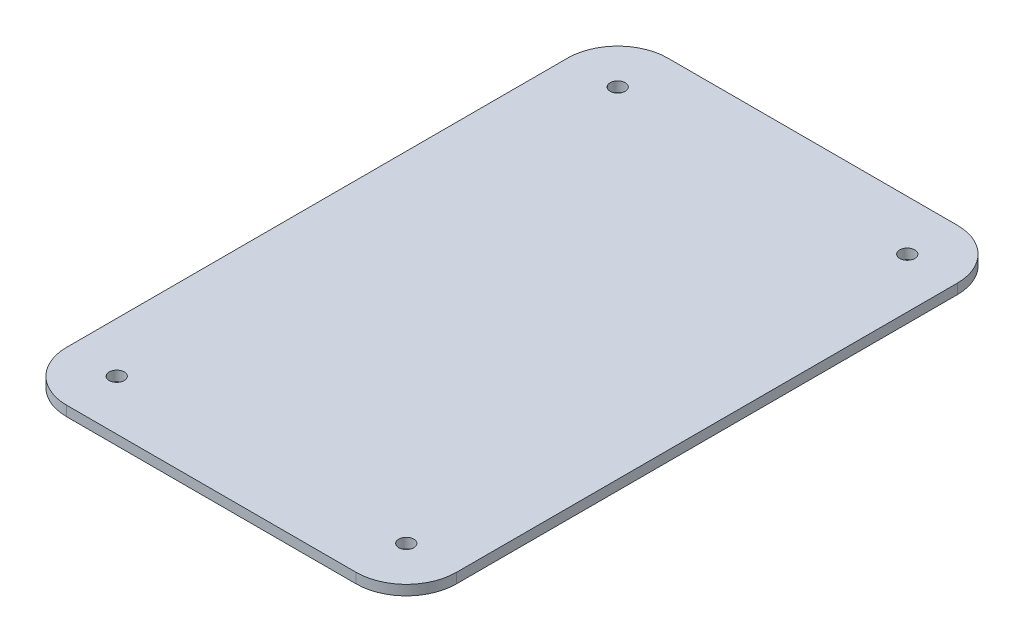
from build123d import *

# Parameters (mm, degrees)
SKETCH1_W           = 77.8
SKETCH1_H           = 120
BOSS_EXTRUDE1_DEPTH = 2
FILLET1_R           = 10
SKETCH2_R           = 1.5
CUT_EXTRUDE1_DEPTH  = 21


with BuildPart() as part:
    # Sketch1 → Boss-Extrude1 (new body)
    with BuildSketch(Plane(origin=(0, 0, 0), x_dir=(1, 0, 0), z_dir=(0, 1, 0))):
        with Locations((-4.469169002, 27.069255629)):
            Rectangle(SKETCH1_W, SKETCH1_H)
    extrude(amount=BOSS_EXTRUDE1_DEPTH)

    # Fillet1
    fillet1_edges = [part.edges().sort_by_distance(p)[0] for p in [
        (-43.369169002, 1, -87.069255629),
        (34.430830998, 1, -87.069255629),
        (34.430830998, 1, 32.930744371),
        (-43.369169002, 1, 32.930744371),
    ]]
    fillet(fillet1_edges, radius=FILLET1_R)

    # Sketch2 → Cut-Extrude1 (cut)
    with BuildSketch(Plane(origin=(0, 2, 0), x_dir=(1, 0, 0), z_dir=(0, 1, 0))):
        with Locations((-33.369169002, -22.930744371)):
            Circle(SKETCH2_R)
        with Locations((24.430830998, -22.930744371)):
            Circle(SKETCH2_R)
        with Locations((-33.369169002, 77.069255629)):
            Circle(SKETCH2_R)
        with Locations((24.430830998, 77.069255629)):
            Circle(SKETCH2_R)
    extrude(amount=-CUT_EXTRUDE1_DEPTH, mode=Mode.SUBTRACT)


solid = part.part
